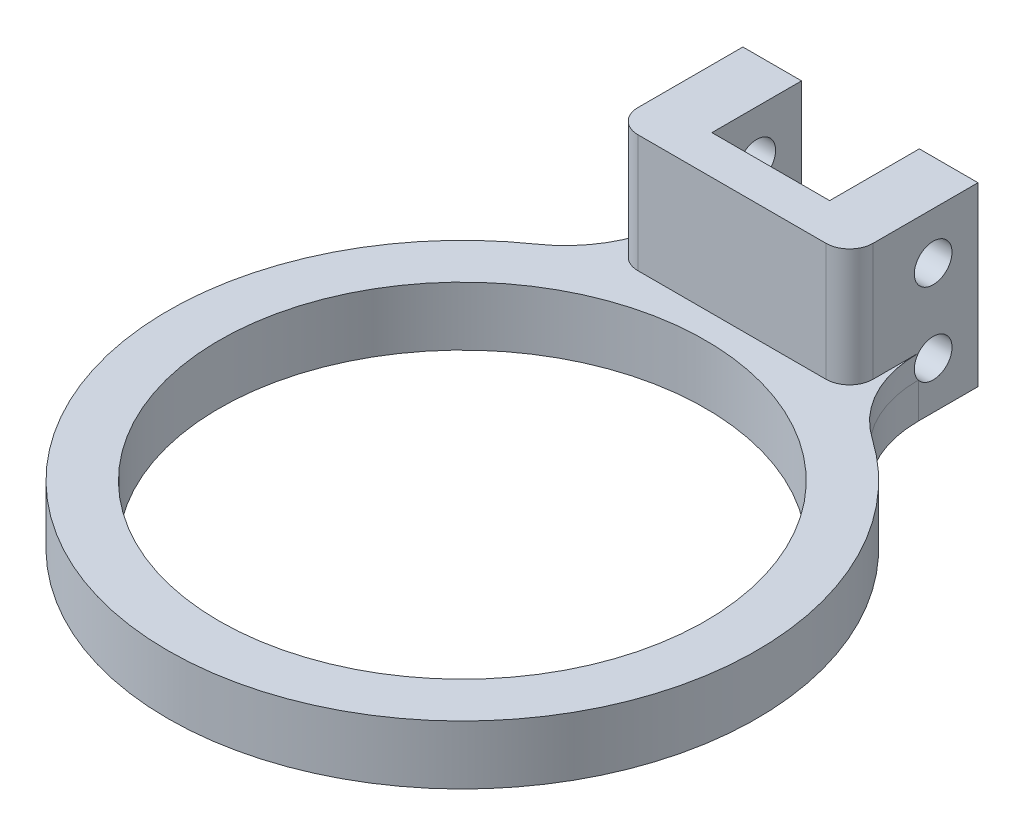
from build123d import *

# Parameters (mm, degrees)
SKETCH_1_R          = 25
SKETCH_1_R_2        = 20.65
EXTRUDE_1_DEPTH     = 5
EXTRUDE_2_DEPTH     = 15
SKETCH_3_R          = 1.6
CUT_EXTRUDE_1_DEPTH = 51.908937006
FILLET_1_R          = 10
FILLET_2_R          = 2


with BuildPart() as part:
    # 草图1 → 凸台-拉伸1 (new body)
    with BuildSketch(Plane(origin=(0, 0, 0), x_dir=(1, 0, 0), z_dir=(0, 1, 0))):
        Circle(SKETCH_1_R)
        Circle(SKETCH_1_R_2, mode=Mode.SUBTRACT)
    extrude(amount=EXTRUDE_1_DEPTH)

    # 草图2 → 凸台-拉伸2 (add)
    with BuildSketch(Plane(origin=(0, 0, 0), x_dir=(1, 0, 0), z_dir=(0, 1, 0))):
        Polygon((-5, 33.807000777), (-9.982946782, 33.807000777), (-9.982946782, 22.896387671), (9.982946782, 22.896387671), (9.982946782, 33.807000777), (5, 33.807000777), (5, 26.192999223), (-5, 26.192999223), align=None)
    extrude(amount=EXTRUDE_2_DEPTH)

    # 草图3 → 切除-拉伸1 (cut, through all)
    with BuildSketch(Plane.ZY.offset(9.982946782)):
        with Locations((-30, 4)):
            Circle(SKETCH_3_R)
        with Locations((-30, 11)):
            Circle(SKETCH_3_R)
    extrude(amount=-CUT_EXTRUDE_1_DEPTH, mode=Mode.SUBTRACT)

    # 圆角1
    fillet_1_edges = [part.edges().sort_by_distance(p)[0] for p in [
        (9.982946782, 2.5, -22.920313557),
        (-9.982946782, 2.5, -22.920313557),
    ]]
    fillet(fillet_1_edges, radius=FILLET_1_R)

    # 圆角2
    fillet_2_edges = [part.edges().sort_by_distance(p)[0] for p in [
        (9.982946782, 10, -22.896387671),
        (-9.982946782, 10, -22.896387671),
    ]]
    fillet(fillet_2_edges, radius=FILLET_2_R)


solid = part.part
